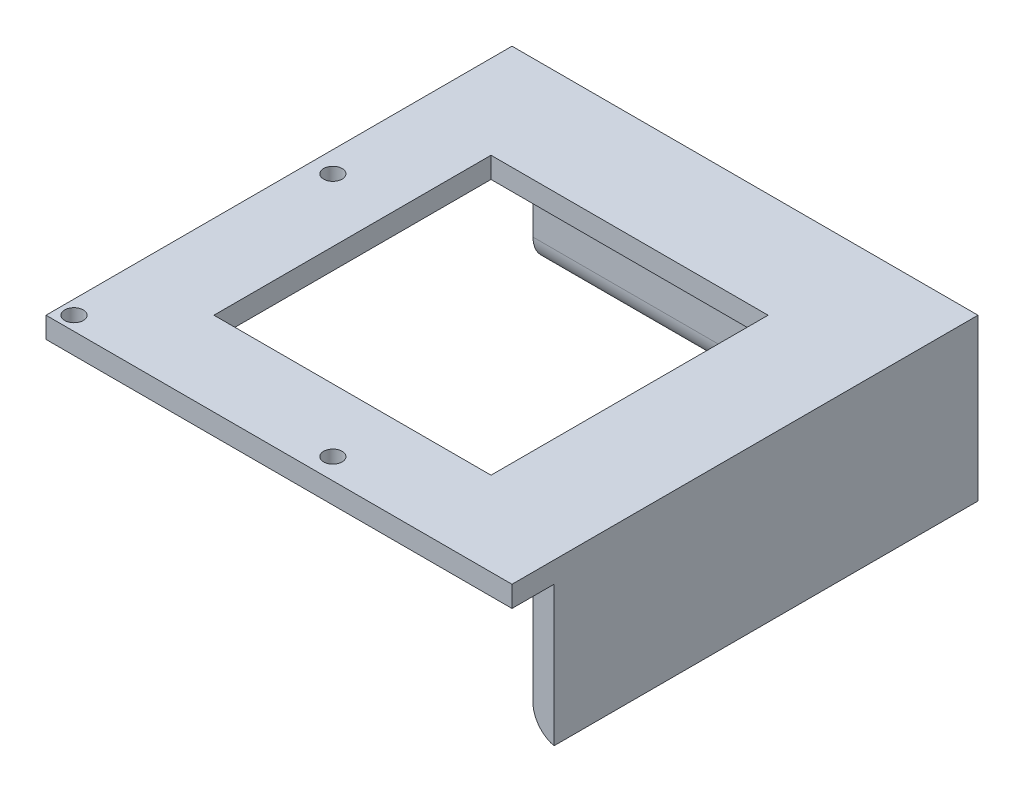
from build123d import *

# Parameters (mm, degrees)
SKETCH2_W           = 105.7275
SKETCH2_H           = 105.7275
BOSS_EXTRUDE1_DEPTH = 4.7625
BOSS_EXTRUDE2_DEPTH = 31.75
SKETCH6_R           = 2.099999991
CUT_EXTRUDE1_DEPTH  = 154.914817899
FILLET1_R           = 6.35
SKETCH7_W           = 62.865
SKETCH7_H           = 62.865
CUT_EXTRUDE2_DEPTH  = 153.855065381


with BuildPart() as part:
    # Sketch2 → Boss-Extrude1 (new body)
    with BuildSketch(Plane(origin=(0, 0, 0), x_dir=(1, 0, 0), z_dir=(0, 1, 0))):
        with Locations((52.86375, 52.86375)):
            Rectangle(SKETCH2_W, SKETCH2_H)
    extrude(amount=BOSS_EXTRUDE1_DEPTH)

    # Sketch5 → Boss-Extrude2 (add)
    with BuildSketch(Plane(origin=(0, 0, 0), x_dir=(1, 0, 0), z_dir=(0, 1, 0))):
        Polygon((105.7275, 9.525), (105.7275, 105.7275), (9.525, 105.7275), (9.525, 100.965), (100.965, 100.965), (100.965, 9.525), align=None)
    extrude(amount=-BOSS_EXTRUDE2_DEPTH)

    # Sketch6 → Cut-Extrude1 (cut, through all)
    with BuildSketch(Plane(origin=(0, 4.7625, 0), x_dir=(1, 0, 0), z_dir=(0, 1, 0))):
        with Locations(Location((3.175, 3.175, 0), (0, 0, 270))):
            Circle(SKETCH6_R)
        with Locations(Location((60.325, 4.7625, 0), (0, 0, 270))):
            Circle(SKETCH6_R)
        with Locations(Location((4.7625, 60.325, 0), (0, 0, 270))):
            Circle(SKETCH6_R)
    extrude(amount=-CUT_EXTRUDE1_DEPTH, mode=Mode.SUBTRACT)

    # Fillet1
    # the kernel refuses this fillet: 6.35 mm, written as the material it takes off along each edge
    with BuildSketch(Plane(origin=(9.525, -31.75, -100.965), x_dir=(0, 0, -1), z_dir=(1, 0, 0)), Plane(origin=(100.965, -31.75, -100.965), x_dir=(1, 0, 0), z_dir=(0, 0, 1))) as fillet1_piece_1:
        with BuildLine():
            CenterArc((6.35, 6.148361062), FILLET1_R, 180, 75.522487814)
            Line((0, 6.148361062), (-0.127, 6.148361062))
            Line((-0.127, 6.148361062), (-0.127, 0))
            Line((-0.127, 0), (0, -0.127))
            ThreePointArc((0, -0.127), (2.38125, -0.127), (4.73075, -0.122967221))
            Line((4.73075, -0.122967221), (4.7625, 0))
        make_face()
    extrude(amount=91.44, mode=Mode.SUBTRACT)
    with BuildSketch(Plane(origin=(9.525, -31.75, -100.965), x_dir=(0, 0, -1), z_dir=(1, 0, 0))) as fillet1_piece_2a_section:
        with BuildLine():
            CenterArc((6.35, 6.148361062), FILLET1_R, 180, 75.522487814)
            Line((0, 6.148361062), (-0.127, 6.148361062))
            Line((-0.127, 6.148361062), (-0.127, 0))
            Line((-0.127, 0), (0, -0.127))
            ThreePointArc((0, -0.127), (2.38125, -0.127), (4.73075, -0.122967221))
            Line((4.73075, -0.122967221), (4.7625, 0))
        make_face()
    fillet1_piece_2a = extrude(amount=106.810902655, mode=Mode.PRIVATE)
    fillet1_piece_2a = split(fillet1_piece_2a, bisect_by=Plane(origin=(100.965, -30.30128496, -102.168907648), z_dir=(1, 0, 0)), keep=Keep.TOP, mode=Mode.PRIVATE)
    with BuildSketch(Plane(origin=(100.965, -31.75, -116.335902655), x_dir=(1, 0, 0), z_dir=(0, 0, 1))) as fillet1_piece_2b_section:
        with BuildLine():
            CenterArc((6.35, 6.148361062), FILLET1_R, 180, 75.522487814)
            Line((0, 6.148361062), (-0.127, 6.148361062))
            Line((-0.127, 6.148361062), (-0.127, 0))
            Line((-0.127, 0), (0, -0.127))
            ThreePointArc((0, -0.127), (2.38125, -0.127), (4.73075, -0.122967221))
            Line((4.73075, -0.122967221), (4.7625, 0))
        make_face()
    fillet1_piece_2b = extrude(amount=106.810902655, mode=Mode.PRIVATE)
    fillet1_piece_2b = split(fillet1_piece_2b, bisect_by=Plane(origin=(102.168907648, -30.30128496, -100.965), z_dir=(0, 0, -1)), keep=Keep.TOP, mode=Mode.PRIVATE)
    fillet1_piece_2 = fillet1_piece_2a & fillet1_piece_2b
    add(fillet1_piece_2, mode=Mode.SUBTRACT)

    # Sketch7 → Cut-Extrude2 (cut, through all)
    with BuildSketch(Plane.XZ):
        with Locations((50.4825, -50.4825)):
            Rectangle(SKETCH7_W, SKETCH7_H)
    extrude(amount=-CUT_EXTRUDE2_DEPTH, mode=Mode.SUBTRACT)


solid = part.part
